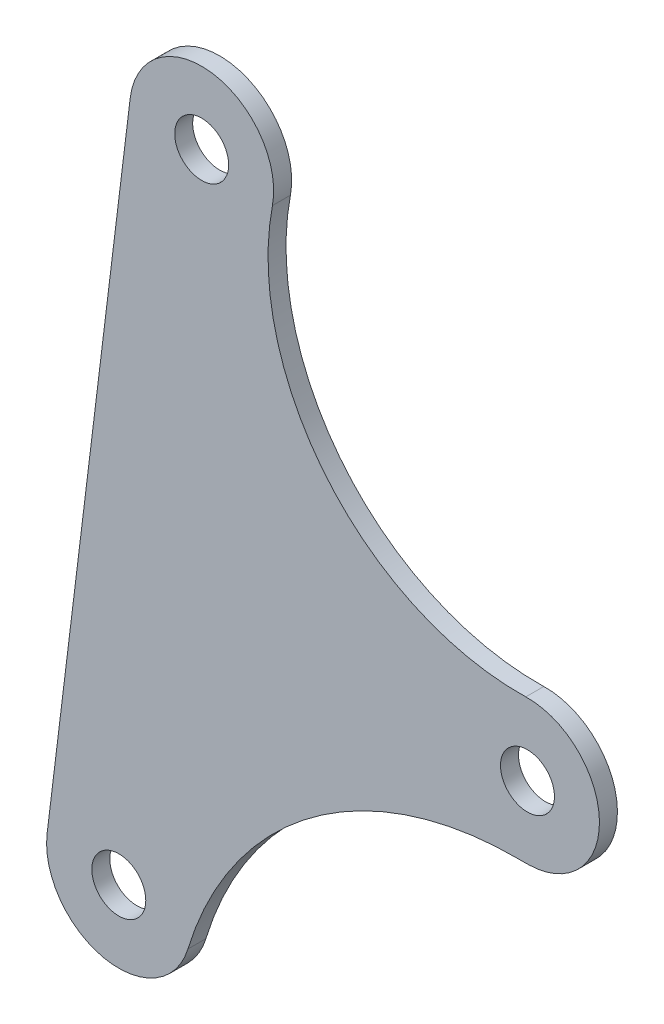
from build123d import *

# Parameters (mm, degrees)
ESQUISSE1_R               = 1.5
T_LE_DE_BASE_PLI_E1_DEPTH = 1


# Sheet-metal steps are written as plain solids
with BuildPart() as part:
    # Esquisse1 → Tôle de base pliée1 (new body)
    with BuildSketch(Plane.XY):
        with BuildLine():
            Line((-58.469338958, -21.747952398), (-53.848876988, 15.970095876))
            ThreePointArc((-53.848876988, 15.970095876), (-49.26123741, 19.438010656), (-45.943968874, 14.740287881))
            ThreePointArc((-45.943968874, 14.740287881), (-42.861840407, 3.075501185), (-31.856499609, -1.869115936))
            ThreePointArc((-31.856499609, -1.869115936), (-27.76403967, -5.778781082), (-31.673704815, -9.871241021))
            ThreePointArc((-31.673704815, -9.871241021), (-31.985478135, -9.876154218), (-32.297289768, -9.876651277))
            ThreePointArc((-32.297289768, -9.876651277), (-43.713897158, -13.595668804), (-50.642240989, -23.40220068))
            ThreePointArc((-50.642240989, -23.40220068), (-55.314375936, -26.164336213), (-58.469338958, -21.747952398))
        make_face()
        with Locations((-54.484155586, -22.236137473)):
            Circle(ESQUISSE1_R, mode=Mode.SUBTRACT)
        with Locations((-31.765102212, -5.870178479)):
            Circle(ESQUISSE1_R, mode=Mode.SUBTRACT)
        with Locations((-49.876465203, 15.483475321)):
            Circle(ESQUISSE1_R, mode=Mode.SUBTRACT)
    extrude(amount=T_LE_DE_BASE_PLI_E1_DEPTH)


solid = part.part
